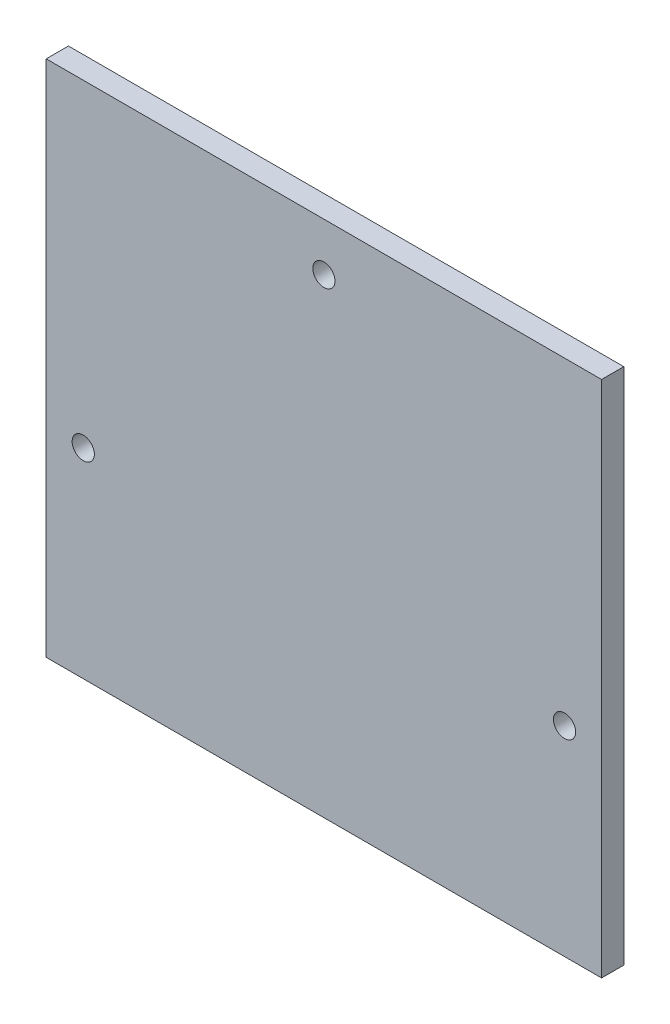
from build123d import *

# Parameters (mm, degrees)
ESQUISSE1_W        = 75
ESQUISSE1_H        = 70
ESQUISSE1_R        = 1.5
BOSS_EXTRU_1_DEPTH = 3


with BuildPart() as part:
    # Esquisse1 → Boss.-Extru.1 (new body)
    with BuildSketch(Plane.XY):
        with Locations((37.5, 35)):
            Rectangle(ESQUISSE1_W, ESQUISSE1_H)
        with Locations((5, 27)):
            Circle(ESQUISSE1_R, mode=Mode.SUBTRACT)
        with Locations((70, 27)):
            Circle(ESQUISSE1_R, mode=Mode.SUBTRACT)
        with Locations((37.5, 63.5)):
            Circle(ESQUISSE1_R, mode=Mode.SUBTRACT)
    extrude(amount=BOSS_EXTRU_1_DEPTH)


solid = part.part
